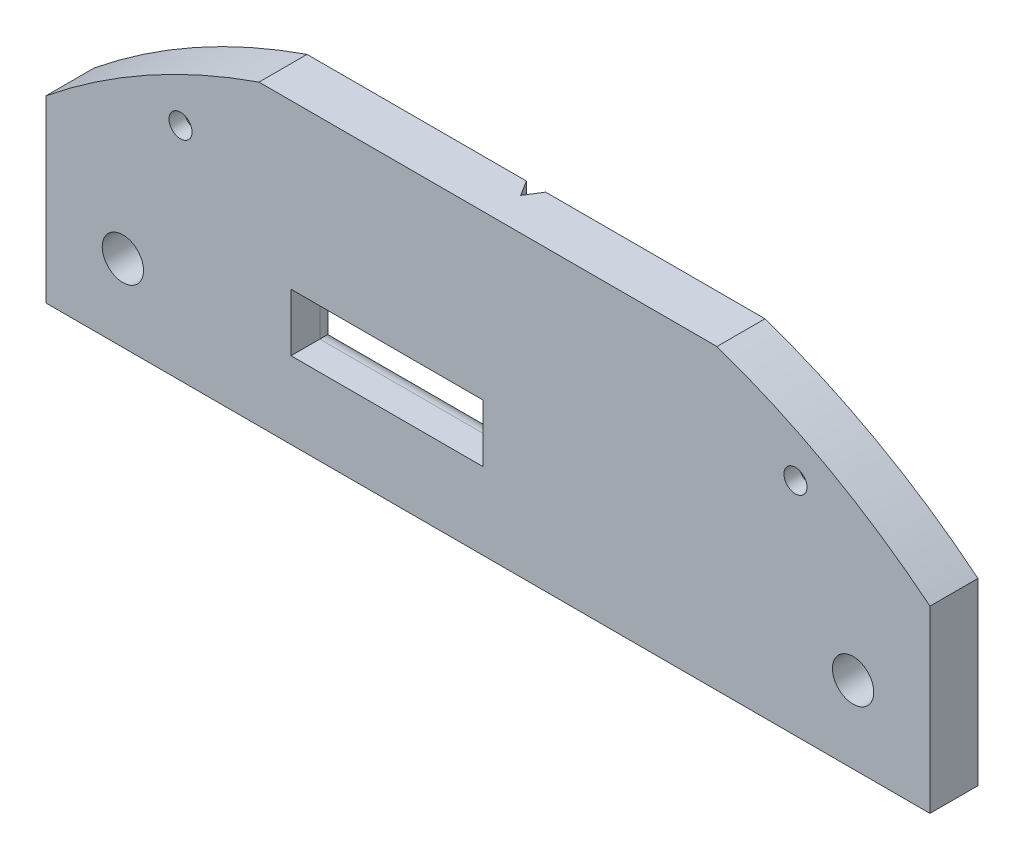
from build123d import *

# Parameters (mm, degrees)
SKETCH3_W           = 92
SKETCH3_H           = 31
BOSS_EXTRUDE2_DEPTH = 5
SKETCH4_R           = 103
SKETCH4_R_2         = 73
CUT_EXTRUDE1_DEPTH  = 49.79805324
SKETCH5_R           = 2.15
CUT_EXTRUDE2_DEPTH  = 49.79805324
CUT_EXTRUDE4_DEPTH  = 56.695601263
SKETCH8_R           = 1.2
CUT_EXTRUDE5_DEPTH  = 49.79805324
SKETCH9_R           = 2.1
CUT_EXTRUDE6_DEPTH  = 3.4
SKETCH10_W          = 20
SKETCH10_H          = 6
CUT_EXTRUDE7_DEPTH  = 49.79805324
FILLET1_R           = 2


with BuildPart() as part:
    # Sketch3 → Boss-Extrude2 (new body)
    with BuildSketch(Plane.XY):
        Rectangle(SKETCH3_W, SKETCH3_H)
    extrude(amount=BOSS_EXTRUDE2_DEPTH)

    # Sketch4 → Cut-Extrude1 (cut, through all)
    with BuildSketch(Plane.XY.offset(5)):
        with Locations((0, -53.5)):
            Circle(SKETCH4_R)
        with Locations((0, -53.5)):
            Circle(SKETCH4_R_2, mode=Mode.SUBTRACT)
    extrude(amount=-CUT_EXTRUDE1_DEPTH, mode=Mode.SUBTRACT)

    # Sketch5 → Cut-Extrude2 (cut, through all)
    with BuildSketch(Plane.XY.offset(5)):
        with Locations((38, -7.5)):
            Circle(SKETCH5_R)
        with Locations(Location((-38, -7.5, 0), (0, 0, 180))):
            Circle(SKETCH5_R)
    extrude(amount=-CUT_EXTRUDE2_DEPTH, mode=Mode.SUBTRACT)

    # Sketch7 → Cut-Extrude4 (cut, through all)
    with BuildSketch(Plane.XZ.offset(15.5)):
        Polygon((-1, 0), (0, 1.6), (1, 0), align=None)
    extrude(amount=-CUT_EXTRUDE4_DEPTH, mode=Mode.SUBTRACT)

    # Sketch8 → Cut-Extrude5 (cut, through all)
    with BuildSketch(Plane.XY.offset(5)):
        with Locations((-32, 7.5)):
            Circle(SKETCH8_R)
        with Locations((32, 7.5)):
            Circle(SKETCH8_R)
    extrude(amount=-CUT_EXTRUDE5_DEPTH, mode=Mode.SUBTRACT)

    # Sketch9 → Cut-Extrude6 (cut)
    with BuildSketch(Plane(origin=(0, 0, 0), x_dir=(-1, 0, 0), z_dir=(0, 0, -1))):
        with Locations((32, 7.5)):
            Circle(SKETCH9_R)
        with Locations((-32, 7.5)):
            Circle(SKETCH9_R)
    extrude(amount=-CUT_EXTRUDE6_DEPTH, mode=Mode.SUBTRACT)

    # Sketch10 → Cut-Extrude7 (cut, through all)
    with BuildSketch(Plane(origin=(0, 0, 0), x_dir=(-1, 0, 0), z_dir=(0, 0, -1))):
        with Locations((10.5, -4.5)):
            Rectangle(SKETCH10_W, SKETCH10_H)
    extrude(amount=-CUT_EXTRUDE7_DEPTH, mode=Mode.SUBTRACT)

    # Fillet1
    # the kernel refuses this fillet: 2 mm, written as the material it takes off along each edge
    with BuildSketch(Plane(origin=(-20.5, -7.5, 0), x_dir=(0, -1, 0), z_dir=(1, 0, 0))) as fillet1_piece_1_section:
        with BuildLine():
            CenterArc((FILLET1_R, -FILLET1_R), FILLET1_R, 90, 90)
            Line((0, -FILLET1_R), (0, 0))
            Line((0, 0), (FILLET1_R, 0))
        make_face()
    fillet1_piece_1 = extrude(amount=24.5, mode=Mode.PRIVATE)
    fillet1_piece_1 = split(fillet1_piece_1, bisect_by=Plane(origin=(-0.5, -7.952790229, 0.452790229), z_dir=(-1, 0, 0)), keep=Keep.TOP, mode=Mode.PRIVATE)
    add(fillet1_piece_1, mode=Mode.SUBTRACT)
    with BuildSketch(Plane(origin=(-20.5, -1.5, 0), x_dir=(-1, 0, 0), z_dir=(0, -1, 0))) as fillet1_piece_2:
        with BuildLine():
            CenterArc((FILLET1_R, -FILLET1_R), FILLET1_R, 90, 90)
            Line((0, -FILLET1_R), (0, 0))
            Line((0, 0), (FILLET1_R, 0))
        make_face()
    extrude(amount=6, mode=Mode.SUBTRACT)
    with BuildSketch(Plane(origin=(4, -1.5, 0), x_dir=(0, 1, 0), z_dir=(-1, 0, 0))) as fillet1_piece_3_section:
        with BuildLine():
            CenterArc((FILLET1_R, -FILLET1_R), FILLET1_R, 90, 90)
            Line((0, -FILLET1_R), (0, 0))
            Line((0, 0), (FILLET1_R, 0))
        make_face()
    fillet1_piece_3 = extrude(amount=24.5, mode=Mode.PRIVATE)
    fillet1_piece_3 = split(fillet1_piece_3, bisect_by=Plane(origin=(-0.5, -1.047209771, 0.452790229), z_dir=(-1, 0, 0)), keep=Keep.TOP, mode=Mode.PRIVATE)
    add(fillet1_piece_3, mode=Mode.SUBTRACT)
    with BuildSketch(Plane(origin=(-25.5, -7.5, 0), x_dir=(0, -1, 0), z_dir=(1, 0, 0))) as fillet1_piece_4a_section:
        with BuildLine():
            CenterArc((FILLET1_R, -FILLET1_R), FILLET1_R, 90, 90)
            Line((0, -FILLET1_R), (0, 0))
            Line((0, 0), (FILLET1_R, 0))
        make_face()
    fillet1_piece_4a = extrude(amount=29.5, mode=Mode.PRIVATE)
    fillet1_piece_4a = split(fillet1_piece_4a, bisect_by=Plane(origin=(-20.5, -7.952790229, 0.452790229), z_dir=(-1, 0, 0)), keep=Keep.TOP, mode=Mode.PRIVATE)
    with BuildSketch(Plane(origin=(-20.5, -1.5, 0), x_dir=(-1, 0, 0), z_dir=(0, -1, 0))) as fillet1_piece_4b_section:
        with BuildLine():
            CenterArc((FILLET1_R, -FILLET1_R), FILLET1_R, 90, 90)
            Line((0, -FILLET1_R), (0, 0))
            Line((0, 0), (FILLET1_R, 0))
        make_face()
    fillet1_piece_4b = extrude(amount=11, mode=Mode.PRIVATE)
    fillet1_piece_4b = split(fillet1_piece_4b, bisect_by=Plane(origin=(-20.952790229, -7.5, 0.452790229), z_dir=(0, -1, 0)), keep=Keep.TOP, mode=Mode.PRIVATE)
    fillet1_piece_4 = fillet1_piece_4a & fillet1_piece_4b
    add(fillet1_piece_4, mode=Mode.SUBTRACT)
    with BuildSketch(Plane(origin=(-20.5, 3.5, 0), x_dir=(-1, 0, 0), z_dir=(0, -1, 0))) as fillet1_piece_5a_section:
        with BuildLine():
            CenterArc((FILLET1_R, -FILLET1_R), FILLET1_R, 90, 90)
            Line((0, -FILLET1_R), (0, 0))
            Line((0, 0), (FILLET1_R, 0))
        make_face()
    fillet1_piece_5a = extrude(amount=11, mode=Mode.PRIVATE)
    fillet1_piece_5a = split(fillet1_piece_5a, bisect_by=Plane(origin=(-20.952790229, -1.5, 0.452790229), z_dir=(0, 1, 0)), keep=Keep.TOP, mode=Mode.PRIVATE)
    with BuildSketch(Plane(origin=(4, -1.5, 0), x_dir=(0, 1, 0), z_dir=(-1, 0, 0))) as fillet1_piece_5b_section:
        with BuildLine():
            CenterArc((FILLET1_R, -FILLET1_R), FILLET1_R, 90, 90)
            Line((0, -FILLET1_R), (0, 0))
            Line((0, 0), (FILLET1_R, 0))
        make_face()
    fillet1_piece_5b = extrude(amount=29.5, mode=Mode.PRIVATE)
    fillet1_piece_5b = split(fillet1_piece_5b, bisect_by=Plane(origin=(-20.5, -1.047209771, 0.452790229), z_dir=(-1, 0, 0)), keep=Keep.TOP, mode=Mode.PRIVATE)
    fillet1_piece_5 = fillet1_piece_5a & fillet1_piece_5b
    add(fillet1_piece_5, mode=Mode.SUBTRACT)


solid = part.part
